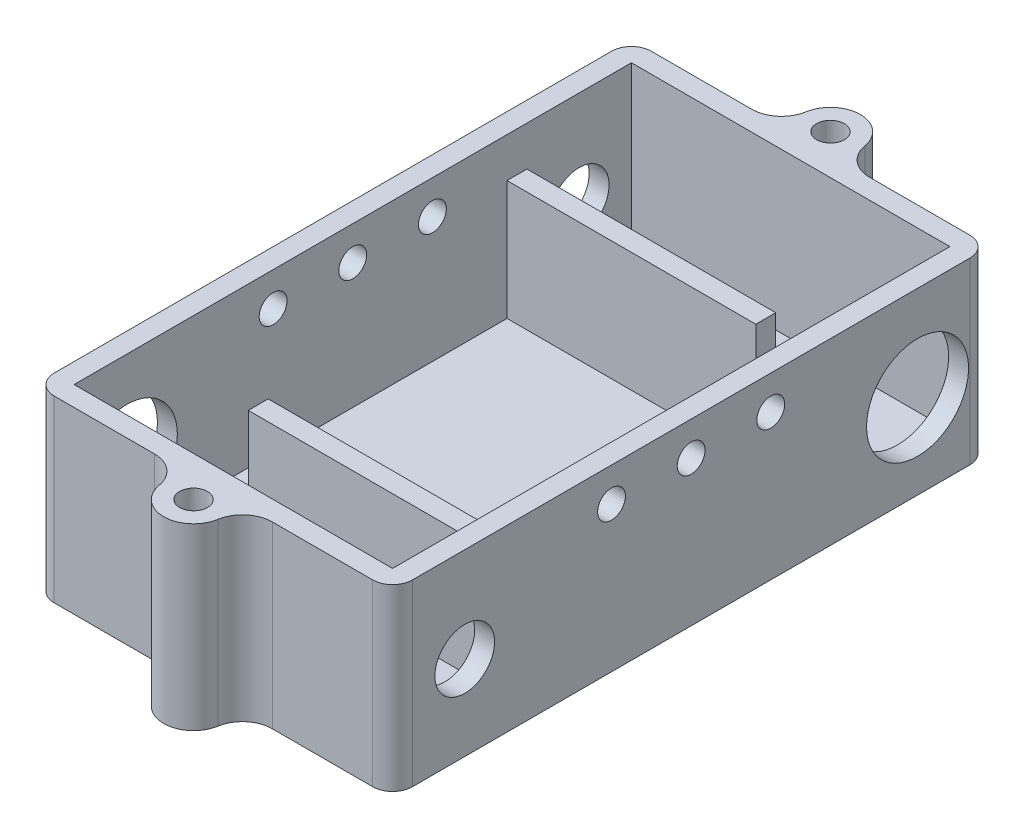
from build123d import *

# Parameters (mm, degrees)
SKETCH_1_W          = 36
SKETCH_1_H          = 60
EXTRUDE_1_DEPTH     = 18
FILLET_1_R          = 2
SHELL_START         = -16
SHELL_1_OUTLINE_W   = 16
SHELL_1_OUTLINE_H   = 56
SHELL_1_DEPTH       = 32
SKETCH_2_W          = 25
SKETCH_2_H          = 2
EXTRUDE_2_DEPTH     = 12
SKETCH_3_R          = 3
CUT_EXTRUDE_1_DEPTH = 14
SKETCH_4_R          = 3
EXTRUDE_3_DEPTH     = 18
FILLET_2_R          = 3
SKETCH_6_W          = 25
SKETCH_6_H          = 2
EXTRUDE_4_DEPTH     = 12
SKETCH_8_R          = 3
CUT_EXTRUDE_2_DEPTH = 14
SKETCH_9_R          = 1.4
CUT_EXTRUDE_3_DEPTH = 10
SKETCH_11_R         = 1.4
CUT_EXTRUDE_5_DEPTH = 66
SKETCH_13_R         = 5.125
CUT_EXTRUDE_6_DEPTH = 66
SKETCH_14_R         = 5.125
CUT_EXTRUDE_7_DEPTH = 66


# Read off the part's stored shape, not the designer's step: 抽壳1
with BuildPart() as part:
    # 草图1 → 凸台-拉伸1 (new body)
    with BuildSketch(Plane(origin=(0, 0, 0), x_dir=(1, 0, 0), z_dir=(0, 1, 0))):
        Rectangle(SKETCH_1_W, SKETCH_1_H)
    extrude(amount=EXTRUDE_1_DEPTH)

    # 圆角1
    fillet_1_edges = [part.edges().sort_by_distance(p)[0] for p in [
        (-18, 9, -30),
        (18, 9, -30),
        (18, 9, 30),
        (-18, 9, 30),
    ]]
    fillet(fillet_1_edges, radius=FILLET_1_R)

    # 抽壳1 outline → 抽壳1 (cut)
    with BuildSketch(Plane.YZ.offset(SHELL_START)):
        with Locations((10, 0)):
            Rectangle(SHELL_1_OUTLINE_W, SHELL_1_OUTLINE_H)
    extrude(amount=SHELL_1_DEPTH, mode=Mode.SUBTRACT)

    # 草图2 → 凸台-拉伸2 (add)
    with BuildSketch(Plane(origin=(0, 2, 0), x_dir=(1, 0, 0), z_dir=(0, 1, 0))):
        with Locations((3.5, -16.5)):
            Rectangle(SKETCH_2_W, SKETCH_2_H)
    extrude(amount=EXTRUDE_2_DEPTH)

    # 草图3 → 切除-拉伸1 (cut)
    with BuildSketch(Plane(origin=(18, 0, 0), x_dir=(0, 0, -1), z_dir=(1, 0, 0))):
        with Locations((-22.75, 8.5)):
            Circle(SKETCH_3_R)
    extrude(amount=-CUT_EXTRUDE_1_DEPTH, mode=Mode.SUBTRACT)

    # 草图4 → 凸台-拉伸3 (add)
    with BuildSketch(Plane(origin=(0, 18, 0), x_dir=(1, 0, 0), z_dir=(0, 1, 0))):
        with Locations((0, 32)):
            Circle(SKETCH_4_R)
        with Locations((0, -32)):
            Circle(SKETCH_4_R)
    extrude(amount=-EXTRUDE_3_DEPTH)

    # 圆角2
    fillet_2_edges = [part.edges().sort_by_distance(p)[0] for p in [
        (2.236067977, 9, -30),
        (-2.236067977, 9, -30),
        (-2.236067977, 9, 30),
        (2.236067977, 9, 30),
    ]]
    fillet(fillet_2_edges, radius=FILLET_2_R)

    # 草图6 → 凸台-拉伸4 (add)
    with BuildSketch(Plane(origin=(0, 2, 0), x_dir=(1, 0, 0), z_dir=(0, 1, 0))):
        with Locations((-3.5, 16.5)):
            Rectangle(SKETCH_6_W, SKETCH_6_H)
    extrude(amount=EXTRUDE_4_DEPTH)

    # 草图8 → 切除-拉伸2 (cut)
    with BuildSketch(Plane.ZY.offset(18)):
        with Locations((-22.75, 8.5)):
            Circle(SKETCH_8_R)
    extrude(amount=-CUT_EXTRUDE_2_DEPTH, mode=Mode.SUBTRACT)

    # 草图9 → 切除-拉伸3 (cut)
    with BuildSketch(Plane(origin=(0, 18, 0), x_dir=(1, 0, 0), z_dir=(0, 1, 0))):
        with Locations(Location((0, 32, 0), (0, 0, 270))):
            Circle(SKETCH_9_R)
        with Locations(Location((0, -32, 0), (0, 0, 270))):
            Circle(SKETCH_9_R)
    extrude(amount=-CUT_EXTRUDE_3_DEPTH, mode=Mode.SUBTRACT)

    # 草图11 → 切除-拉伸5 (cut)
    with BuildSketch(Plane(origin=(18, 0, 0), x_dir=(0, 0, -1), z_dir=(1, 0, 0))):
        with Locations((-8, 14.6)):
            Circle(SKETCH_11_R)
        with Locations((0, 14.6)):
            Circle(SKETCH_11_R)
        with Locations((8, 14.6)):
            Circle(SKETCH_11_R)
    extrude(amount=-CUT_EXTRUDE_5_DEPTH, mode=Mode.SUBTRACT)

    # 草图13 → 切除-拉伸6 (cut)
    with BuildSketch(Plane.ZY.offset(-16)):
        with Locations((-22.75, 8.5)):
            Circle(SKETCH_13_R)
    extrude(amount=-CUT_EXTRUDE_6_DEPTH, mode=Mode.SUBTRACT)

    # 草图14 → 切除-拉伸7 (cut)
    with BuildSketch(Plane(origin=(-16, 0, 0), x_dir=(0, 0, -1), z_dir=(1, 0, 0))):
        with Locations((-22.75, 8.5)):
            Circle(SKETCH_14_R)
    extrude(amount=-CUT_EXTRUDE_7_DEPTH, mode=Mode.SUBTRACT)


solid = part.part
